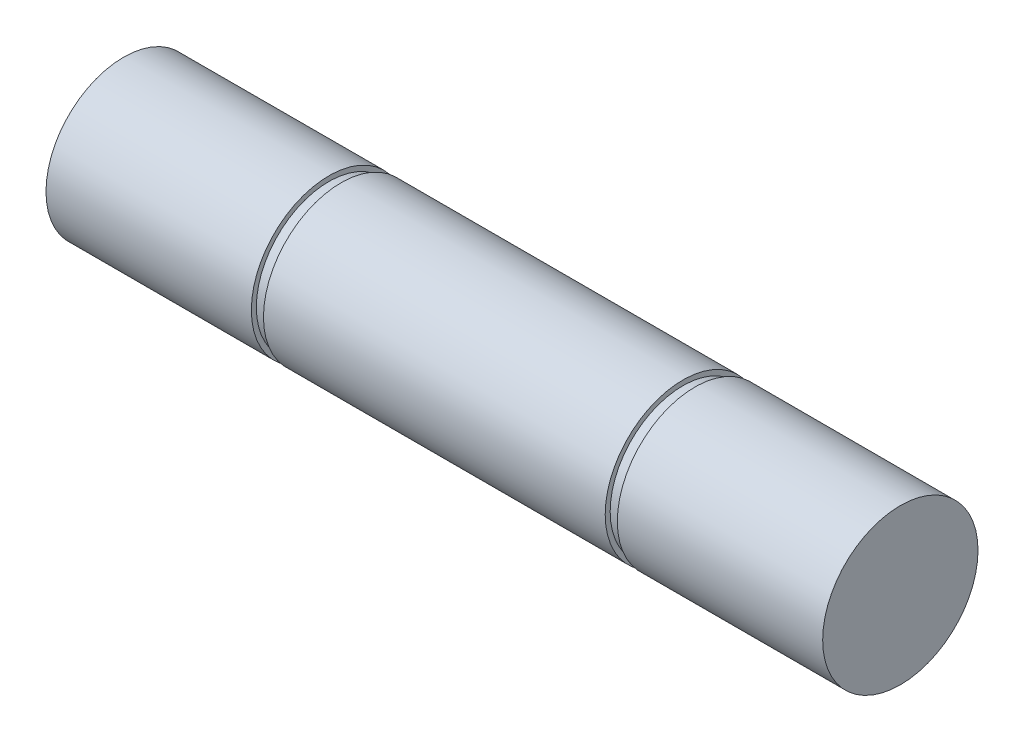
from build123d import *

# Parameters (mm, degrees)
SKETCH1_R           = 6.35
BOSS_EXTRUDE1_DEPTH = 63.5
CUT_EXTRUDE1_START  = 0.9906
SKETCH2_R           = 6.35
SKETCH2_R_2         = 5.9436
CUT_EXTRUDE1_DEPTH  = 0.9906


with BuildPart() as part:
    # Sketch1 → Boss-Extrude1 (new body)
    with BuildSketch(Plane(origin=(0, 0, 0), x_dir=(0, 0, -1), z_dir=(1, 0, 0))):
        Circle(SKETCH1_R)
    extrude(amount=BOSS_EXTRUDE1_DEPTH)

    # Sketch2 → Cut-Extrude1 (cut)
    with BuildSketch(Plane.ZY.offset(-17.78).offset(CUT_EXTRUDE1_START)):
        Circle(SKETCH2_R)
        Circle(SKETCH2_R_2, mode=Mode.SUBTRACT)
    cut_extrude1 = extrude(amount=-CUT_EXTRUDE1_DEPTH, mode=Mode.SUBTRACT)

    # Mirror1: Cut-Extrude1 across plane
    add(cut_extrude1.mirror(Plane.ZY.offset(-31.75)), mode=Mode.SUBTRACT)


solid = part.part
